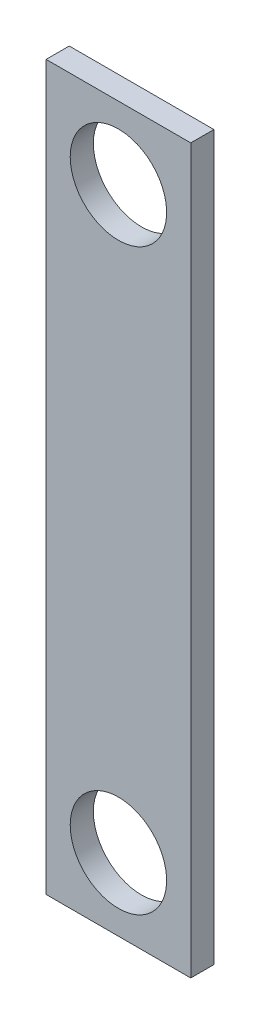
from build123d import *

# Parameters (mm, degrees)
SKETCH1_W           = 19.05
SKETCH1_H           = 95.25
SKETCH1_R           = 6.35
BOSS_EXTRUDE2_DEPTH = 3.048


with BuildPart() as part:
    # Sketch1 → Boss-Extrude2 (new body)
    with BuildSketch(Plane.XY):
        with Locations((0, -38.1)):
            Rectangle(SKETCH1_W, SKETCH1_H)
        Circle(SKETCH1_R, mode=Mode.SUBTRACT)
        with Locations((0, -76.2)):
            Circle(SKETCH1_R, mode=Mode.SUBTRACT)
    extrude(amount=BOSS_EXTRUDE2_DEPTH)


solid = part.part
